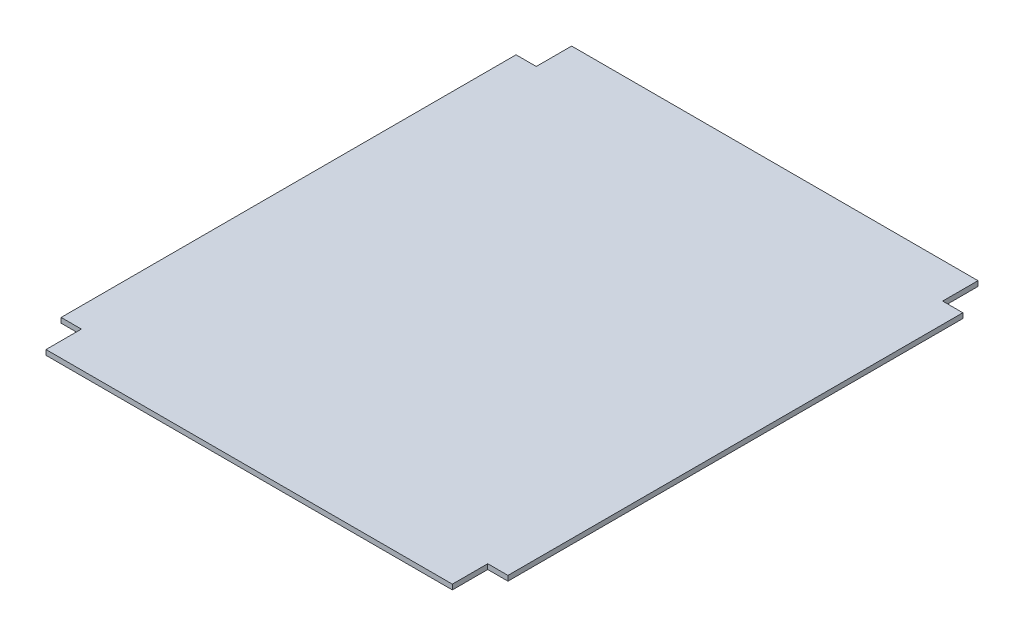
from build123d import *

# Parameters (mm, degrees)
BOSS_EXTRUDE1_DEPTH = 0.5


with BuildPart() as part:
    # Sketch1 → Boss-Extrude1 (new body)
    with BuildSketch(Plane(origin=(0, 0, 0), x_dir=(1, 0, 0), z_dir=(0, 1, 0))):
        Polygon((0, 0), (0, 3.5), (-2, 3.5), (-2, 48.5), (0, 48.5), (0, 52), (40.2, 52), (40.2, 48.5), (42.2, 48.5), (42.2, 3.5), (40.2, 3.5), (40.2, 0), align=None)
    extrude(amount=BOSS_EXTRUDE1_DEPTH)


solid = part.part
